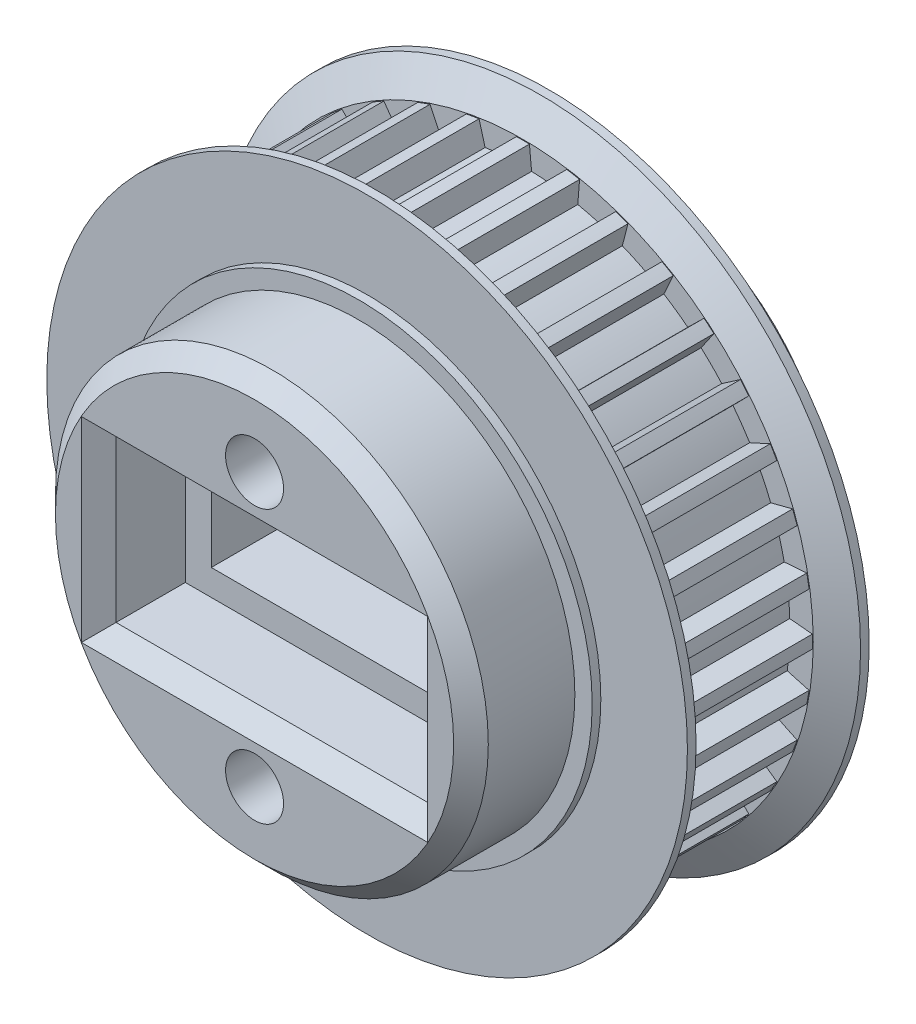
from build123d import *
from OCP.BRepFilletAPI import BRepFilletAPI_MakeChamfer
from build123d.topology import SkipClean

# Parameters (mm, degrees)
CROQUIS1_R                 = 2
SALIENTE_EXTRUIR1_DEPTH    = 7.5
CROQUIS2_R                 = 18.5
CROQUIS2_R_2               = 2
SALIENTE_EXTRUIR2_DEPTH    = 1.5
SALIENTE_EXTRUIR4_START    = 6.5
CROQUIS4_R                 = 12.5
CROQUIS4_R_2               = 2
SALIENTE_EXTRUIR4_DEPTH    = 6.5
SALIENTE_EXTRUIR6_START    = 1.5
CROQUIS6_R                 = 18.5
CROQUIS6_R_2               = 2
SALIENTE_EXTRUIR6_DEPTH    = 1.5
SALIENTE_EXTRUIR5_START    = 0.5
CROQUIS5_R                 = 13.5
CROQUIS5_R_2               = 2
SALIENTE_EXTRUIR5_DEPTH    = 0.5
CHAFL_N2_SIZE              = 1
CHAFL_N2_SIZE2             = 1.732050808
CROQUIS3_R                 = 12.5
CROQUIS3_R_2               = 2
SALIENTE_EXTRUIR7_DEPTH    = 6.5
CHAFL_N4_SIZE              = 1
CROQUIS7_R                 = 13.5
CROQUIS7_R_2               = 2
SALIENTE_EXTRUIR8_DEPTH    = 0.5
CORTAR_EXTRUIR1_DEPTH      = 31.409702399
CORTAR_EXTRUIR1_DEPTH_BACK = 31.409702399
CROQUIS8_R                 = 1.675
CROQUIS8_W                 = 15
CROQUIS8_H                 = 6.3
CORTAR_EXTRUIR2_DEPTH      = 7
REDONDEO1_R                = 2.5
CROQUIS10_W                = 18
CROQUIS10_H                = 9.3
CORTAR_EXTRUIR3_DEPTH      = 5
CHAFL_N5_SIZE              = 1


with BuildPart() as part:
    # Croquis1 → Saliente-Extruir1 (new body)
    with BuildSketch(Plane.XY):
        with BuildLine():
            Line((-0.375, 16.714216942), (-0.5, 15.410313844))
            ThreePointArc((-0.5, 15.410313844), (-1.343804123, 15.359751406), (-2.18356904, 15.263020639))
            Line((-2.18356904, 15.263020639), (-2.533090406, 16.525408497))
            ThreePointArc((-2.533090406, 16.525408497), (-2.903123715, 16.464432747), (-3.271696221, 16.395172363))
            Line((-3.271696221, 16.395172363), (-3.168376793, 15.089372461))
            ThreePointArc((-3.168376793, 15.089372461), (-3.99058156, 14.893053132), (-4.800791439, 14.651968275))
            Line((-4.800791439, 14.651968275), (-5.364214141, 15.834483876))
            ThreePointArc((-5.364214141, 15.834483876), (-5.718037486, 15.710178876), (-6.068983607, 15.577968769))
            Line((-6.068983607, 15.577968769), (-5.74048406, 14.309948132))
            ThreePointArc((-5.74048406, 14.309948132), (-6.516107195, 13.973836975), (-7.27214422, 13.595723269))
            Line((-7.27214422, 13.595723269), (-8.032348945, 14.662436476))
            ThreePointArc((-8.032348945, 14.662436476), (-8.35921158, 14.478579169), (-8.681867997, 14.287436476))
            Line((-8.681867997, 14.287436476), (-8.138169624, 13.095723269))
            ThreePointArc((-8.138169624, 13.095723269), (-8.843644211, 12.630032852), (-9.522536579, 12.126379092))
            Line((-9.522536579, 12.126379092), (-10.45642489, 13.044878363))
            ThreePointArc((-10.45642489, 13.044878363), (-10.746395261, 12.80705516), (-11.030958222, 12.562787656))
            Line((-11.030958222, 12.562787656), (-10.288581022, 11.483591482))
            ThreePointArc((-10.288581022, 11.483591482), (-10.902471572, 10.902471572), (-11.483591482, 10.288581022))
            Line((-11.483591482, 10.288581022), (-12.562787656, 11.030958222))
            ThreePointArc((-12.562787656, 11.030958222), (-12.80705516, 10.746395261), (-13.044878363, 10.45642489))
            Line((-13.044878363, 10.45642489), (-12.126379092, 9.522536579))
            ThreePointArc((-12.126379092, 9.522536579), (-12.630032852, 8.843644211), (-13.095723269, 8.138169624))
            Line((-13.095723269, 8.138169624), (-14.287436476, 8.681867997))
            ThreePointArc((-14.287436476, 8.681867997), (-14.478579169, 8.35921158), (-14.662436476, 8.032348945))
            Line((-14.662436476, 8.032348945), (-13.595723269, 7.27214422))
            ThreePointArc((-13.595723269, 7.27214422), (-13.973836975, 6.516107195), (-14.309948132, 5.74048406))
            Line((-14.309948132, 5.74048406), (-15.577968769, 6.068983607))
            ThreePointArc((-15.577968769, 6.068983607), (-15.710178876, 5.718037486), (-15.834483876, 5.364214141))
            Line((-15.834483876, 5.364214141), (-14.651968275, 4.800791439))
            ThreePointArc((-14.651968275, 4.800791439), (-14.893053132, 3.99058156), (-15.089372461, 3.168376793))
            Line((-15.089372461, 3.168376793), (-16.395172363, 3.271696221))
            ThreePointArc((-16.395172363, 3.271696221), (-16.464432747, 2.903123715), (-16.525408497, 2.533090406))
            Line((-16.525408497, 2.533090406), (-15.263020639, 2.18356904))
            ThreePointArc((-15.263020639, 2.18356904), (-15.359751406, 1.343804123), (-15.410313844, 0.5))
            Line((-15.410313844, 0.5), (-16.714216942, 0.375))
            ThreePointArc((-16.714216942, 0.375), (-16.718423161, 0), (-16.714216942, -0.375))
            Line((-16.714216942, -0.375), (-15.410313844, -0.5))
            ThreePointArc((-15.410313844, -0.5), (-15.359751406, -1.343804123), (-15.263020639, -2.18356904))
            Line((-15.263020639, -2.18356904), (-16.525408497, -2.533090406))
            ThreePointArc((-16.525408497, -2.533090406), (-16.464432747, -2.903123715), (-16.395172363, -3.271696221))
            Line((-16.395172363, -3.271696221), (-15.089372461, -3.168376793))
            ThreePointArc((-15.089372461, -3.168376793), (-14.893053132, -3.99058156), (-14.651968275, -4.800791439))
            Line((-14.651968275, -4.800791439), (-15.834483876, -5.364214141))
            ThreePointArc((-15.834483876, -5.364214141), (-15.710178876, -5.718037486), (-15.577968769, -6.068983607))
            Line((-15.577968769, -6.068983607), (-14.309948132, -5.74048406))
            ThreePointArc((-14.309948132, -5.74048406), (-13.973836975, -6.516107195), (-13.595723269, -7.27214422))
            Line((-13.595723269, -7.27214422), (-14.662436476, -8.032348945))
            ThreePointArc((-14.662436476, -8.032348945), (-14.478579169, -8.35921158), (-14.287436476, -8.681867997))
            Line((-14.287436476, -8.681867997), (-13.095723269, -8.138169624))
            ThreePointArc((-13.095723269, -8.138169624), (-12.630032852, -8.843644211), (-12.126379092, -9.522536579))
            Line((-12.126379092, -9.522536579), (-13.044878363, -10.45642489))
            ThreePointArc((-13.044878363, -10.45642489), (-12.80705516, -10.746395261), (-12.562787656, -11.030958222))
            Line((-12.562787656, -11.030958222), (-11.483591482, -10.288581022))
            ThreePointArc((-11.483591482, -10.288581022), (-10.902471572, -10.902471572), (-10.288581022, -11.483591482))
            Line((-10.288581022, -11.483591482), (-11.030958222, -12.562787656))
            ThreePointArc((-11.030958222, -12.562787656), (-10.746395261, -12.80705516), (-10.45642489, -13.044878363))
            Line((-10.45642489, -13.044878363), (-9.522536579, -12.126379092))
            ThreePointArc((-9.522536579, -12.126379092), (-8.843644211, -12.630032852), (-8.138169624, -13.095723269))
            Line((-8.138169624, -13.095723269), (-8.681867997, -14.287436476))
            ThreePointArc((-8.681867997, -14.287436476), (-8.35921158, -14.478579169), (-8.032348945, -14.662436476))
            Line((-8.032348945, -14.662436476), (-7.27214422, -13.595723269))
            ThreePointArc((-7.27214422, -13.595723269), (-6.516107195, -13.973836975), (-5.74048406, -14.309948132))
            Line((-5.74048406, -14.309948132), (-6.068983607, -15.577968769))
            ThreePointArc((-6.068983607, -15.577968769), (-5.718037486, -15.710178876), (-5.364214141, -15.834483876))
            Line((-5.364214141, -15.834483876), (-4.800791439, -14.651968275))
            ThreePointArc((-4.800791439, -14.651968275), (-3.99058156, -14.893053132), (-3.168376793, -15.089372461))
            Line((-3.168376793, -15.089372461), (-3.271696221, -16.395172363))
            ThreePointArc((-3.271696221, -16.395172363), (-2.903123715, -16.464432747), (-2.533090406, -16.525408497))
            Line((-2.533090406, -16.525408497), (-2.18356904, -15.263020639))
            ThreePointArc((-2.18356904, -15.263020639), (-1.343804123, -15.359751406), (-0.5, -15.410313844))
            Line((-0.5, -15.410313844), (-0.375, -16.714216942))
            ThreePointArc((-0.375, -16.714216942), (0, -16.718423161), (0.375, -16.714216942))
            Line((0.375, -16.714216942), (0.5, -15.410313844))
            ThreePointArc((0.5, -15.410313844), (1.343804123, -15.359751406), (2.18356904, -15.263020639))
            Line((2.18356904, -15.263020639), (2.533090406, -16.525408497))
            ThreePointArc((2.533090406, -16.525408497), (2.903123715, -16.464432747), (3.271696221, -16.395172363))
            Line((3.271696221, -16.395172363), (3.168376793, -15.089372461))
            ThreePointArc((3.168376793, -15.089372461), (3.99058156, -14.893053132), (4.800791439, -14.651968275))
            Line((4.800791439, -14.651968275), (5.364214141, -15.834483876))
            ThreePointArc((5.364214141, -15.834483876), (5.718037486, -15.710178876), (6.068983607, -15.577968769))
            Line((6.068983607, -15.577968769), (5.74048406, -14.309948132))
            ThreePointArc((5.74048406, -14.309948132), (6.516107195, -13.973836975), (7.27214422, -13.595723269))
            Line((7.27214422, -13.595723269), (8.032348945, -14.662436476))
            ThreePointArc((8.032348945, -14.662436476), (8.35921158, -14.478579169), (8.681867997, -14.287436476))
            Line((8.681867997, -14.287436476), (8.138169624, -13.095723269))
            ThreePointArc((8.138169624, -13.095723269), (8.843644211, -12.630032852), (9.522536579, -12.126379092))
            Line((9.522536579, -12.126379092), (10.45642489, -13.044878363))
            ThreePointArc((10.45642489, -13.044878363), (10.746395261, -12.80705516), (11.030958222, -12.562787656))
            Line((11.030958222, -12.562787656), (10.288581022, -11.483591482))
            ThreePointArc((10.288581022, -11.483591482), (10.902471572, -10.902471572), (11.483591482, -10.288581022))
            Line((11.483591482, -10.288581022), (12.562787656, -11.030958222))
            ThreePointArc((12.562787656, -11.030958222), (12.80705516, -10.746395261), (13.044878363, -10.45642489))
            Line((13.044878363, -10.45642489), (12.126379092, -9.522536579))
            ThreePointArc((12.126379092, -9.522536579), (12.630032852, -8.843644211), (13.095723269, -8.138169624))
            Line((13.095723269, -8.138169624), (14.287436476, -8.681867997))
            ThreePointArc((14.287436476, -8.681867997), (14.478579169, -8.35921158), (14.662436476, -8.032348945))
            Line((14.662436476, -8.032348945), (13.595723269, -7.27214422))
            ThreePointArc((13.595723269, -7.27214422), (13.973836975, -6.516107195), (14.309948132, -5.74048406))
            Line((14.309948132, -5.74048406), (15.577968769, -6.068983607))
            ThreePointArc((15.577968769, -6.068983607), (15.710178876, -5.718037486), (15.834483876, -5.364214141))
            Line((15.834483876, -5.364214141), (14.651968275, -4.800791439))
            ThreePointArc((14.651968275, -4.800791439), (14.893053132, -3.99058156), (15.089372461, -3.168376793))
            Line((15.089372461, -3.168376793), (16.395172363, -3.271696221))
            ThreePointArc((16.395172363, -3.271696221), (16.464432747, -2.903123715), (16.525408497, -2.533090406))
            Line((16.525408497, -2.533090406), (15.263020639, -2.18356904))
            ThreePointArc((15.263020639, -2.18356904), (15.359751406, -1.343804123), (15.410313844, -0.5))
            Line((15.410313844, -0.5), (16.714216942, -0.375))
            ThreePointArc((16.714216942, -0.375), (16.718423161, 0), (16.714216942, 0.375))
            Line((16.714216942, 0.375), (15.410313844, 0.5))
            ThreePointArc((15.410313844, 0.5), (15.359751406, 1.343804123), (15.263020639, 2.18356904))
            Line((15.263020639, 2.18356904), (16.525408497, 2.533090406))
            ThreePointArc((16.525408497, 2.533090406), (16.464432747, 2.903123715), (16.395172363, 3.271696221))
            Line((16.395172363, 3.271696221), (15.089372461, 3.168376793))
            ThreePointArc((15.089372461, 3.168376793), (14.893053132, 3.99058156), (14.651968275, 4.800791439))
            Line((14.651968275, 4.800791439), (15.834483876, 5.364214141))
            ThreePointArc((15.834483876, 5.364214141), (15.710178876, 5.718037486), (15.577968769, 6.068983607))
            Line((15.577968769, 6.068983607), (14.309948132, 5.74048406))
            ThreePointArc((14.309948132, 5.74048406), (13.973836975, 6.516107195), (13.595723269, 7.27214422))
            Line((13.595723269, 7.27214422), (14.662436476, 8.032348945))
            ThreePointArc((14.662436476, 8.032348945), (14.478579169, 8.35921158), (14.287436476, 8.681867997))
            Line((14.287436476, 8.681867997), (13.095723269, 8.138169624))
            ThreePointArc((13.095723269, 8.138169624), (12.630032852, 8.843644211), (12.126379092, 9.522536579))
            Line((12.126379092, 9.522536579), (13.044878363, 10.45642489))
            ThreePointArc((13.044878363, 10.45642489), (12.80705516, 10.746395261), (12.562787656, 11.030958222))
            Line((12.562787656, 11.030958222), (11.483591482, 10.288581022))
            ThreePointArc((11.483591482, 10.288581022), (10.902471572, 10.902471572), (10.288581022, 11.483591482))
            Line((10.288581022, 11.483591482), (11.030958222, 12.562787656))
            ThreePointArc((11.030958222, 12.562787656), (10.746395261, 12.80705516), (10.45642489, 13.044878363))
            Line((10.45642489, 13.044878363), (9.522536579, 12.126379092))
            ThreePointArc((9.522536579, 12.126379092), (8.843644211, 12.630032852), (8.138169624, 13.095723269))
            Line((8.138169624, 13.095723269), (8.681867997, 14.287436476))
            ThreePointArc((8.681867997, 14.287436476), (8.35921158, 14.478579169), (8.032348945, 14.662436476))
            Line((8.032348945, 14.662436476), (7.27214422, 13.595723269))
            ThreePointArc((7.27214422, 13.595723269), (6.516107195, 13.973836975), (5.74048406, 14.309948132))
            Line((5.74048406, 14.309948132), (6.068983607, 15.577968769))
            ThreePointArc((6.068983607, 15.577968769), (5.718037486, 15.710178876), (5.364214141, 15.834483876))
            Line((5.364214141, 15.834483876), (4.800791439, 14.651968275))
            ThreePointArc((4.800791439, 14.651968275), (3.99058156, 14.893053132), (3.168376793, 15.089372461))
            Line((3.168376793, 15.089372461), (3.271696221, 16.395172363))
            ThreePointArc((3.271696221, 16.395172363), (2.903123715, 16.464432747), (2.533090406, 16.525408497))
            Line((2.533090406, 16.525408497), (2.18356904, 15.263020639))
            ThreePointArc((2.18356904, 15.263020639), (1.343804123, 15.359751406), (0.5, 15.410313844))
            Line((0.5, 15.410313844), (0.375, 16.714216942))
            ThreePointArc((0.375, 16.714216942), (0, 16.718423161), (-0.375, 16.714216942))
        make_face()
        Circle(CROQUIS1_R, mode=Mode.SUBTRACT)
    extrude(amount=SALIENTE_EXTRUIR1_DEPTH)

    # Croquis2 → Saliente-Extruir2 (add)
    with BuildSketch(Plane.XY.offset(7.5)):
        Circle(CROQUIS2_R)
        Circle(CROQUIS2_R_2, mode=Mode.SUBTRACT)
    extrude(amount=SALIENTE_EXTRUIR2_DEPTH)

    # Croquis4 → Saliente-Extruir4 (add)
    with BuildSketch(Plane(origin=(0, 0, 0), x_dir=(-1, 0, 0), z_dir=(0, 0, -1)).offset(SALIENTE_EXTRUIR4_START)):
        with Locations(Location((0, 0, 0), (0, 0, 180))):
            Circle(CROQUIS4_R)
        Circle(CROQUIS4_R_2, mode=Mode.SUBTRACT)
    extrude(amount=-SALIENTE_EXTRUIR4_DEPTH)

    # Croquis6 → Saliente-Extruir6 (add)
    with SkipClean():  # the faces are left unmerged after this step: merging them gives an invalid solid
        with BuildSketch(Plane(origin=(0, 0, 0), x_dir=(-1, 0, 0), z_dir=(0, 0, -1)).offset(SALIENTE_EXTRUIR6_START)):
            with Locations(Location((0, 0, 0), (0, 0, 180))):
                Circle(CROQUIS6_R)
            Circle(CROQUIS6_R_2, mode=Mode.SUBTRACT)
        extrude(amount=-SALIENTE_EXTRUIR6_DEPTH)

    # Croquis5 → Saliente-Extruir5 (add)
    with SkipClean():  # the faces are left unmerged after this step: merging them gives an invalid solid
        with BuildSketch(Plane(origin=(0, 0, -1.5), x_dir=(-1, 0, 0), z_dir=(0, 0, -1)).offset(SALIENTE_EXTRUIR5_START)):
            Circle(CROQUIS5_R)
            Circle(CROQUIS5_R_2, mode=Mode.SUBTRACT)
        extrude(amount=-SALIENTE_EXTRUIR5_DEPTH)

    # Chaflán2: one chamfer whose edges measure the first distance from different faces: ONE call of the kernel's chamfer builder (chamfer() names one face for all edges)
    chafl_n2_edges_1 = [part.edges().sort_by_distance(p)[0] for p in [
        (-18.5, 0, 7.5),
    ]]
    chafl_n2_side_1 = [part.faces().sort_by_distance(p)[0] for p in [
        (-18.5, 0, 8.25),
    ]]
    chafl_n2_edges_2 = [part.edges().sort_by_distance(p)[0] for p in [
        (-18.5, 0, 0),
    ]]
    chafl_n2_side_2 = [part.faces().sort_by_distance(p)[0] for p in [
        (-18.5, 0, -0.75),
    ]]
    chafl_n2 = BRepFilletAPI_MakeChamfer(part.part.solid().wrapped)
    for e in chafl_n2_edges_1:
        chafl_n2.Add(CHAFL_N2_SIZE, CHAFL_N2_SIZE2, e.wrapped, chafl_n2_side_1[0].wrapped)  # the first distance lies on this face
    for e in chafl_n2_edges_2:
        chafl_n2.Add(CHAFL_N2_SIZE, CHAFL_N2_SIZE2, e.wrapped, chafl_n2_side_2[0].wrapped)  # the first distance lies on this face
    add(Compound.cast(chafl_n2.Shape()), mode=Mode.REPLACE)

    # Croquis3 → Saliente-Extruir7 (add)
    with BuildSketch(Plane.XY.offset(9)):
        with Locations(Location((0, 0, 0), (0, 0, 180))):
            Circle(CROQUIS3_R)
        with Locations(Location((0, 0, 0), (0, 0, 180))):
            Circle(CROQUIS3_R_2, mode=Mode.SUBTRACT)
    extrude(amount=SALIENTE_EXTRUIR7_DEPTH)

    # Chaflán4
    chafl_n4_edges = [part.edges().sort_by_distance(p)[0] for p in [
        (-12.5, 0, -6.5),
        (12.5, 0, 15.5),
    ]]
    chamfer(chafl_n4_edges, length=CHAFL_N4_SIZE)

    # Croquis7 → Saliente-Extruir8 (add)
    with BuildSketch(Plane.XY.offset(9)):
        with Locations(Location((0, 0, 0), (0, 0, 180))):
            Circle(CROQUIS7_R)
        with Locations(Location((0, 0, 0), (0, 0, 180))):
            Circle(CROQUIS7_R_2, mode=Mode.SUBTRACT)
    extrude(amount=SALIENTE_EXTRUIR8_DEPTH)

    # Croquis8 → Cortar-Extruir1 (cut, two sides: drawn at the far end of the back side and taken through both)
    with BuildSketch(Plane.XY.offset(-CORTAR_EXTRUIR1_DEPTH_BACK)):
        with Locations((0, 7.875631857)):
            Circle(CROQUIS8_R)
        with Locations((0, -7.875631857)):
            Circle(CROQUIS8_R)
        Rectangle(CROQUIS8_W, CROQUIS8_H)
    extrude(amount=CORTAR_EXTRUIR1_DEPTH + CORTAR_EXTRUIR1_DEPTH_BACK, mode=Mode.SUBTRACT)

    # Croquis9 → Cortar-Extruir2 (cut)
    with BuildSketch(Plane(origin=(0, 0, -6.5), x_dir=(-1, 0, 0), z_dir=(0, 0, -1))):
        Polygon((2.33826859, 3.825631857), (4.67653718, 7.875631857), (2.33826859, 11.925631857), (-2.33826859, 11.925631857), (-4.67653718, 7.875631857), (-2.33826859, 3.825631857), align=None)
        Polygon((2.33826859, -11.925631857), (4.67653718, -7.875631857), (2.33826859, -3.825631857), (-2.33826859, -3.825631857), (-4.67653718, -7.875631857), (-2.33826859, -11.925631857), align=None)
    extrude(amount=-CORTAR_EXTRUIR2_DEPTH, mode=Mode.SUBTRACT)

    # Redondeo1
    redondeo1_edges = [part.edges().sort_by_distance(p)[0] for p in [
        (0, 3.825631857, 0.5),
        (3.507402885, 5.850631857, 0.5),
        (3.507402885, 9.900631857, 0.5),
        (0, 11.925631857, 0.5),
        (-3.507402885, 9.900631857, 0.5),
        (-3.507402885, 5.850631857, 0.5),
        (0, -11.925631857, 0.5),
        (3.507402885, -9.900631857, 0.5),
        (3.507402885, -5.850631857, 0.5),
        (0, -3.825631857, 0.5),
        (-3.507402885, -5.850631857, 0.5),
        (-3.507402885, -9.900631857, 0.5),
    ]]
    fillet(redondeo1_edges, radius=REDONDEO1_R)

    # Croquis10 → Cortar-Extruir3 (cut)
    with BuildSketch(Plane.XY.offset(15.5)):
        Rectangle(CROQUIS10_W, CROQUIS10_H)
    extrude(amount=-CORTAR_EXTRUIR3_DEPTH, mode=Mode.SUBTRACT)

    # Chaflán5
    # the kernel refuses this chamfer: 1 mm, written as the material it takes off along each edge
    with BuildSketch(Plane(origin=(-7.5, -3.15, -6.5), x_dir=(-0.9996219169112968, 0, -0.02749587661058651), z_dir=(0, 1, 0)), Plane(origin=(7.5, 3.15, -6.5), x_dir=(0.9996219169112968, 0, -0.02749587661058651), z_dir=(0, -1, 0))) as chafl_n5_piece_1:
        Polygon((CHAFL_N5_SIZE * 0.999621916911, CHAFL_N5_SIZE * 0.0274958766106), (-CHAFL_N5_SIZE * 0.0274958766106, CHAFL_N5_SIZE * 0.999621916911), (0, 0), align=None)
    extrude(amount=6.3, mode=Mode.SUBTRACT)
    with BuildSketch(Plane(origin=(-7.5, 3.15, -6.5), x_dir=(0, 0.9996219169112968, -0.027495876610586487), z_dir=(1, 0, 0)), Plane(origin=(7.5, -3.15, -6.5), x_dir=(0, -0.9996219169112968, -0.027495876610586487), z_dir=(-1, 0, 0))) as chafl_n5_piece_2:
        Polygon((CHAFL_N5_SIZE * 0.999621916911, CHAFL_N5_SIZE * 0.0274958766106), (-CHAFL_N5_SIZE * 0.0274958766106, CHAFL_N5_SIZE * 0.999621916911), (0, 0), align=None)
    extrude(amount=15, mode=Mode.SUBTRACT)
    with BuildSketch(Plane(origin=(9, -4.65, 15.5), x_dir=(0.9996219169112968, 0, 0.027495876610585647), z_dir=(0, 1, 0)), Plane(origin=(-9, 4.65, 15.5), x_dir=(-0.9996219169112968, 0, 0.027495876610585647), z_dir=(0, -1, 0))) as chafl_n5_piece_3:
        Polygon((CHAFL_N5_SIZE * 0.999621916911, CHAFL_N5_SIZE * 0.0274958766106), (-CHAFL_N5_SIZE * 0.0274958766106, CHAFL_N5_SIZE * 0.999621916911), (0, 0), align=None)
    extrude(amount=9.3, mode=Mode.SUBTRACT)
    with BuildSketch(Plane(origin=(9, 4.65, 15.5), x_dir=(0, 0.9996219169112968, 0.027495876610585623), z_dir=(-1, 0, 0)), Plane(origin=(-9, -4.65, 15.5), x_dir=(0, -0.9996219169112968, 0.027495876610585623), z_dir=(1, 0, 0))) as chafl_n5_piece_4:
        Polygon((CHAFL_N5_SIZE * 0.999621916911, CHAFL_N5_SIZE * 0.0274958766106), (-CHAFL_N5_SIZE * 0.0274958766106, CHAFL_N5_SIZE * 0.999621916911), (0, 0), align=None)
    extrude(amount=18, mode=Mode.SUBTRACT)
    with BuildSketch(Plane(origin=(-7.5, -5.721682988, -6.5), x_dir=(-0.9996219169112968, 0, -0.02749587661058651), z_dir=(0, 1, 0))) as chafl_n5_piece_5a_section:
        Polygon((CHAFL_N5_SIZE * 0.999621916911, CHAFL_N5_SIZE * 0.0274958766106), (-CHAFL_N5_SIZE * 0.0274958766106, CHAFL_N5_SIZE * 0.999621916911), (0, 0), align=None)
    chafl_n5_piece_5a = extrude(amount=8.871682988, mode=Mode.PRIVATE)
    chafl_n5_piece_5a = split(chafl_n5_piece_5a, bisect_by=Plane(origin=(-7.829793627, -3.15, -6.170206373), z_dir=(0, -1, 0)), keep=Keep.TOP, mode=Mode.PRIVATE)
    with BuildSketch(Plane(origin=(7.5, -3.15, -6.5), x_dir=(0, -0.9996219169112968, -0.027495876610586487), z_dir=(-1, 0, 0))) as chafl_n5_piece_5b_section:
        Polygon((CHAFL_N5_SIZE * 0.999621916911, CHAFL_N5_SIZE * 0.0274958766106), (-CHAFL_N5_SIZE * 0.0274958766106, CHAFL_N5_SIZE * 0.999621916911), (0, 0), align=None)
    chafl_n5_piece_5b = extrude(amount=17.571682988, mode=Mode.PRIVATE)
    chafl_n5_piece_5b = split(chafl_n5_piece_5b, bisect_by=Plane(origin=(-7.5, -3.479793627, -6.170206373), z_dir=(-1, 0, 0)), keep=Keep.TOP, mode=Mode.PRIVATE)
    chafl_n5_piece_5 = chafl_n5_piece_5a & chafl_n5_piece_5b
    add(chafl_n5_piece_5, mode=Mode.SUBTRACT)
    with BuildSketch(Plane(origin=(-10.071682988, 3.15, -6.5), x_dir=(0, 0.9996219169112968, -0.027495876610586487), z_dir=(1, 0, 0))) as chafl_n5_piece_6a_section:
        Polygon((CHAFL_N5_SIZE * 0.999621916911, CHAFL_N5_SIZE * 0.0274958766106), (-CHAFL_N5_SIZE * 0.0274958766106, CHAFL_N5_SIZE * 0.999621916911), (0, 0), align=None)
    chafl_n5_piece_6a = extrude(amount=17.571682988, mode=Mode.PRIVATE)
    chafl_n5_piece_6a = split(chafl_n5_piece_6a, bisect_by=Plane(origin=(-7.5, 3.479793627, -6.170206373), z_dir=(-1, 0, 0)), keep=Keep.TOP, mode=Mode.PRIVATE)
    with BuildSketch(Plane(origin=(-7.5, -3.15, -6.5), x_dir=(-0.9996219169112968, 0, -0.02749587661058651), z_dir=(0, 1, 0))) as chafl_n5_piece_6b_section:
        Polygon((CHAFL_N5_SIZE * 0.999621916911, CHAFL_N5_SIZE * 0.0274958766106), (-CHAFL_N5_SIZE * 0.0274958766106, CHAFL_N5_SIZE * 0.999621916911), (0, 0), align=None)
    chafl_n5_piece_6b = extrude(amount=8.871682988, mode=Mode.PRIVATE)
    chafl_n5_piece_6b = split(chafl_n5_piece_6b, bisect_by=Plane(origin=(-7.829793627, 3.15, -6.170206373), z_dir=(0, 1, 0)), keep=Keep.TOP, mode=Mode.PRIVATE)
    chafl_n5_piece_6 = chafl_n5_piece_6a & chafl_n5_piece_6b
    add(chafl_n5_piece_6, mode=Mode.SUBTRACT)
    with BuildSketch(Plane(origin=(-7.5, 3.15, -6.5), x_dir=(0, 0.9996219169112968, -0.027495876610586487), z_dir=(1, 0, 0))) as chafl_n5_piece_7a_section:
        Polygon((CHAFL_N5_SIZE * 0.999621916911, CHAFL_N5_SIZE * 0.0274958766106), (-CHAFL_N5_SIZE * 0.0274958766106, CHAFL_N5_SIZE * 0.999621916911), (0, 0), align=None)
    chafl_n5_piece_7a = extrude(amount=17.571682988, mode=Mode.PRIVATE)
    chafl_n5_piece_7a = split(chafl_n5_piece_7a, bisect_by=Plane(origin=(7.5, 3.479793627, -6.170206373), z_dir=(1, 0, 0)), keep=Keep.TOP, mode=Mode.PRIVATE)
    with BuildSketch(Plane(origin=(7.5, 5.721682988, -6.5), x_dir=(0.9996219169112968, 0, -0.02749587661058651), z_dir=(0, -1, 0))) as chafl_n5_piece_7b_section:
        Polygon((CHAFL_N5_SIZE * 0.999621916911, CHAFL_N5_SIZE * 0.0274958766106), (-CHAFL_N5_SIZE * 0.0274958766106, CHAFL_N5_SIZE * 0.999621916911), (0, 0), align=None)
    chafl_n5_piece_7b = extrude(amount=8.871682988, mode=Mode.PRIVATE)
    chafl_n5_piece_7b = split(chafl_n5_piece_7b, bisect_by=Plane(origin=(7.829793627, 3.15, -6.170206373), z_dir=(0, 1, 0)), keep=Keep.TOP, mode=Mode.PRIVATE)
    chafl_n5_piece_7 = chafl_n5_piece_7a & chafl_n5_piece_7b
    add(chafl_n5_piece_7, mode=Mode.SUBTRACT)
    with BuildSketch(Plane(origin=(7.5, 3.15, -6.5), x_dir=(0.9996219169112968, 0, -0.02749587661058651), z_dir=(0, -1, 0))) as chafl_n5_piece_8a_section:
        Polygon((CHAFL_N5_SIZE * 0.999621916911, CHAFL_N5_SIZE * 0.0274958766106), (-CHAFL_N5_SIZE * 0.0274958766106, CHAFL_N5_SIZE * 0.999621916911), (0, 0), align=None)
    chafl_n5_piece_8a = extrude(amount=8.871682988, mode=Mode.PRIVATE)
    chafl_n5_piece_8a = split(chafl_n5_piece_8a, bisect_by=Plane(origin=(7.829793627, -3.15, -6.170206373), z_dir=(0, -1, 0)), keep=Keep.TOP, mode=Mode.PRIVATE)
    with BuildSketch(Plane(origin=(10.071682988, -3.15, -6.5), x_dir=(0, -0.9996219169112968, -0.027495876610586487), z_dir=(-1, 0, 0))) as chafl_n5_piece_8b_section:
        Polygon((CHAFL_N5_SIZE * 0.999621916911, CHAFL_N5_SIZE * 0.0274958766106), (-CHAFL_N5_SIZE * 0.0274958766106, CHAFL_N5_SIZE * 0.999621916911), (0, 0), align=None)
    chafl_n5_piece_8b = extrude(amount=17.571682988, mode=Mode.PRIVATE)
    chafl_n5_piece_8b = split(chafl_n5_piece_8b, bisect_by=Plane(origin=(7.5, -3.479793627, -6.170206373), z_dir=(1, 0, 0)), keep=Keep.TOP, mode=Mode.PRIVATE)
    chafl_n5_piece_8 = chafl_n5_piece_8a & chafl_n5_piece_8b
    add(chafl_n5_piece_8, mode=Mode.SUBTRACT)
    with BuildSketch(Plane(origin=(-9, -4.65, 15.5), x_dir=(0, -0.9996219169112968, 0.027495876610585623), z_dir=(1, 0, 0))) as chafl_n5_piece_9a_section:
        Polygon((CHAFL_N5_SIZE * 0.999621916911, CHAFL_N5_SIZE * 0.0274958766106), (-CHAFL_N5_SIZE * 0.0274958766106, CHAFL_N5_SIZE * 0.999621916911), (0, 0), align=None)
    chafl_n5_piece_9a = extrude(amount=20.571682988, mode=Mode.PRIVATE)
    chafl_n5_piece_9a = split(chafl_n5_piece_9a, bisect_by=Plane(origin=(9, -4.979793627, 15.170206373), z_dir=(1, 0, 0)), keep=Keep.TOP, mode=Mode.PRIVATE)
    with BuildSketch(Plane(origin=(9, -7.221682988, 15.5), x_dir=(0.9996219169112968, 0, 0.027495876610585647), z_dir=(0, 1, 0))) as chafl_n5_piece_9b_section:
        Polygon((CHAFL_N5_SIZE * 0.999621916911, CHAFL_N5_SIZE * 0.0274958766106), (-CHAFL_N5_SIZE * 0.0274958766106, CHAFL_N5_SIZE * 0.999621916911), (0, 0), align=None)
    chafl_n5_piece_9b = extrude(amount=11.871682988, mode=Mode.PRIVATE)
    chafl_n5_piece_9b = split(chafl_n5_piece_9b, bisect_by=Plane(origin=(9.329793627, -4.65, 15.170206373), z_dir=(0, -1, 0)), keep=Keep.TOP, mode=Mode.PRIVATE)
    chafl_n5_piece_9 = chafl_n5_piece_9a & chafl_n5_piece_9b
    add(chafl_n5_piece_9, mode=Mode.SUBTRACT)
    with BuildSketch(Plane(origin=(11.571682988, 4.65, 15.5), x_dir=(0, 0.9996219169112968, 0.027495876610585623), z_dir=(-1, 0, 0))) as chafl_n5_piece_10a_section:
        Polygon((CHAFL_N5_SIZE * 0.999621916911, CHAFL_N5_SIZE * 0.0274958766106), (-CHAFL_N5_SIZE * 0.0274958766106, CHAFL_N5_SIZE * 0.999621916911), (0, 0), align=None)
    chafl_n5_piece_10a = extrude(amount=20.571682988, mode=Mode.PRIVATE)
    chafl_n5_piece_10a = split(chafl_n5_piece_10a, bisect_by=Plane(origin=(9, 4.979793627, 15.170206373), z_dir=(1, 0, 0)), keep=Keep.TOP, mode=Mode.PRIVATE)
    with BuildSketch(Plane(origin=(9, -4.65, 15.5), x_dir=(0.9996219169112968, 0, 0.027495876610585647), z_dir=(0, 1, 0))) as chafl_n5_piece_10b_section:
        Polygon((CHAFL_N5_SIZE * 0.999621916911, CHAFL_N5_SIZE * 0.0274958766106), (-CHAFL_N5_SIZE * 0.0274958766106, CHAFL_N5_SIZE * 0.999621916911), (0, 0), align=None)
    chafl_n5_piece_10b = extrude(amount=11.871682988, mode=Mode.PRIVATE)
    chafl_n5_piece_10b = split(chafl_n5_piece_10b, bisect_by=Plane(origin=(9.329793627, 4.65, 15.170206373), z_dir=(0, 1, 0)), keep=Keep.TOP, mode=Mode.PRIVATE)
    chafl_n5_piece_10 = chafl_n5_piece_10a & chafl_n5_piece_10b
    add(chafl_n5_piece_10, mode=Mode.SUBTRACT)
    with BuildSketch(Plane(origin=(9, 4.65, 15.5), x_dir=(0, 0.9996219169112968, 0.027495876610585623), z_dir=(-1, 0, 0))) as chafl_n5_piece_11a_section:
        Polygon((CHAFL_N5_SIZE * 0.999621916911, CHAFL_N5_SIZE * 0.0274958766106), (-CHAFL_N5_SIZE * 0.0274958766106, CHAFL_N5_SIZE * 0.999621916911), (0, 0), align=None)
    chafl_n5_piece_11a = extrude(amount=20.571682988, mode=Mode.PRIVATE)
    chafl_n5_piece_11a = split(chafl_n5_piece_11a, bisect_by=Plane(origin=(-9, 4.979793627, 15.170206373), z_dir=(-1, 0, 0)), keep=Keep.TOP, mode=Mode.PRIVATE)
    with BuildSketch(Plane(origin=(-9, 7.221682988, 15.5), x_dir=(-0.9996219169112968, 0, 0.027495876610585647), z_dir=(0, -1, 0))) as chafl_n5_piece_11b_section:
        Polygon((CHAFL_N5_SIZE * 0.999621916911, CHAFL_N5_SIZE * 0.0274958766106), (-CHAFL_N5_SIZE * 0.0274958766106, CHAFL_N5_SIZE * 0.999621916911), (0, 0), align=None)
    chafl_n5_piece_11b = extrude(amount=11.871682988, mode=Mode.PRIVATE)
    chafl_n5_piece_11b = split(chafl_n5_piece_11b, bisect_by=Plane(origin=(-9.329793627, 4.65, 15.170206373), z_dir=(0, 1, 0)), keep=Keep.TOP, mode=Mode.PRIVATE)
    chafl_n5_piece_11 = chafl_n5_piece_11a & chafl_n5_piece_11b
    add(chafl_n5_piece_11, mode=Mode.SUBTRACT)
    with BuildSketch(Plane(origin=(-9, 4.65, 15.5), x_dir=(-0.9996219169112968, 0, 0.027495876610585647), z_dir=(0, -1, 0))) as chafl_n5_piece_12a_section:
        Polygon((CHAFL_N5_SIZE * 0.999621916911, CHAFL_N5_SIZE * 0.0274958766106), (-CHAFL_N5_SIZE * 0.0274958766106, CHAFL_N5_SIZE * 0.999621916911), (0, 0), align=None)
    chafl_n5_piece_12a = extrude(amount=11.871682988, mode=Mode.PRIVATE)
    chafl_n5_piece_12a = split(chafl_n5_piece_12a, bisect_by=Plane(origin=(-9.329793627, -4.65, 15.170206373), z_dir=(0, -1, 0)), keep=Keep.TOP, mode=Mode.PRIVATE)
    with BuildSketch(Plane(origin=(-11.571682988, -4.65, 15.5), x_dir=(0, -0.9996219169112968, 0.027495876610585623), z_dir=(1, 0, 0))) as chafl_n5_piece_12b_section:
        Polygon((CHAFL_N5_SIZE * 0.999621916911, CHAFL_N5_SIZE * 0.0274958766106), (-CHAFL_N5_SIZE * 0.0274958766106, CHAFL_N5_SIZE * 0.999621916911), (0, 0), align=None)
    chafl_n5_piece_12b = extrude(amount=20.571682988, mode=Mode.PRIVATE)
    chafl_n5_piece_12b = split(chafl_n5_piece_12b, bisect_by=Plane(origin=(-9, -4.979793627, 15.170206373), z_dir=(-1, 0, 0)), keep=Keep.TOP, mode=Mode.PRIVATE)
    chafl_n5_piece_12 = chafl_n5_piece_12a & chafl_n5_piece_12b
    add(chafl_n5_piece_12, mode=Mode.SUBTRACT)


solid = part.part
